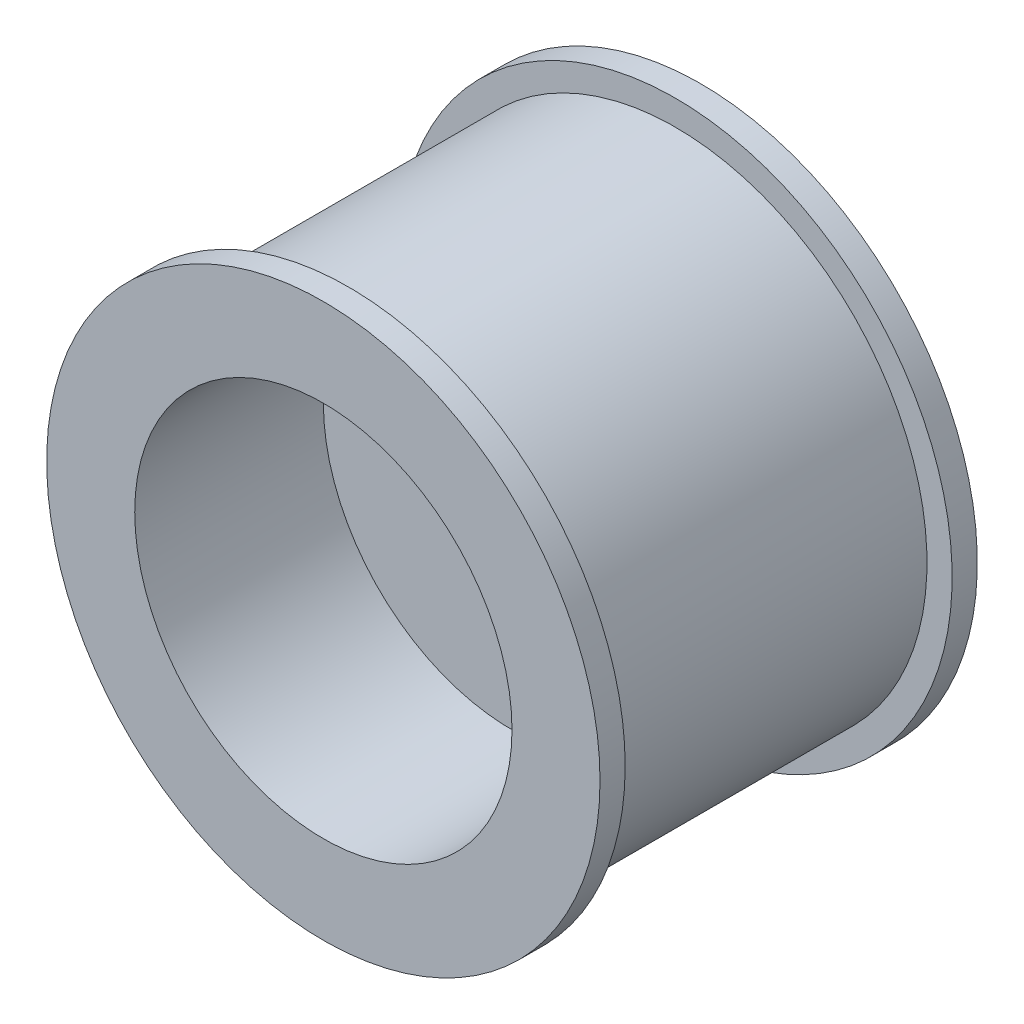
from build123d import *

# Parameters (mm, degrees)
CROQUIS2_R              = 20
SALIENTE_EXTRUIR1_DEPTH = 26
CROQUIS3_R              = 22
SALIENTE_EXTRUIR2_DEPTH = 2
SALIENTE_EXTRUIR3_START = 2
CROQUIS4_R              = 22
SALIENTE_EXTRUIR3_DEPTH = 2
CROQUIS5_R              = 15
CORTAR_EXTRUIR1_DEPTH   = 15
CROQUIS6_R              = 3
CORTAR_EXTRUIR2_DEPTH   = 35.539832078
CROQUIS7_R              = 3
CORTAR_EXTRUIR3_DEPTH   = 10


with BuildPart() as part:
    # Croquis2 → Saliente-Extruir1 (new body)
    with BuildSketch(Plane.XY):
        Circle(CROQUIS2_R)
    extrude(amount=SALIENTE_EXTRUIR1_DEPTH)

    # Croquis3 → Saliente-Extruir2 (add)
    with BuildSketch(Plane.XY.offset(26)):
        Circle(CROQUIS3_R)
    extrude(amount=SALIENTE_EXTRUIR2_DEPTH)

    # Croquis4 → Saliente-Extruir3 (add)
    with BuildSketch(Plane(origin=(0, 0, 0), x_dir=(-1, 0, 0), z_dir=(0, 0, -1)).offset(SALIENTE_EXTRUIR3_START)):
        Circle(CROQUIS4_R)
    extrude(amount=-SALIENTE_EXTRUIR3_DEPTH)

    # Croquis5 → Cortar-Extruir1 (cut)
    with BuildSketch(Plane.XY.offset(28)):
        Circle(CROQUIS5_R)
    extrude(amount=-CORTAR_EXTRUIR1_DEPTH, mode=Mode.SUBTRACT)

    # Croquis6 → Cortar-Extruir2 (cut, through all)
    with BuildSketch(Plane.XY.offset(13)):
        Circle(CROQUIS6_R)
    extrude(amount=-CORTAR_EXTRUIR2_DEPTH, mode=Mode.SUBTRACT)

    # Croquis7 → Cortar-Extruir3 (cut)
    with BuildSketch(Plane(origin=(0, 0, -2), x_dir=(-1, 0, 0), z_dir=(0, 0, -1))):
        with Locations((0, 12.5)):
            Circle(CROQUIS7_R)
        with Locations((10.825317547, 6.25)):
            Circle(CROQUIS7_R)
        with Locations((10.825317547, -6.25)):
            Circle(CROQUIS7_R)
        with Locations((0, -12.5)):
            Circle(CROQUIS7_R)
        with Locations((-10.825317547, -6.25)):
            Circle(CROQUIS7_R)
        with Locations((-10.825317547, 6.25)):
            Circle(CROQUIS7_R)
    extrude(amount=-CORTAR_EXTRUIR3_DEPTH, mode=Mode.SUBTRACT)


solid = part.part
